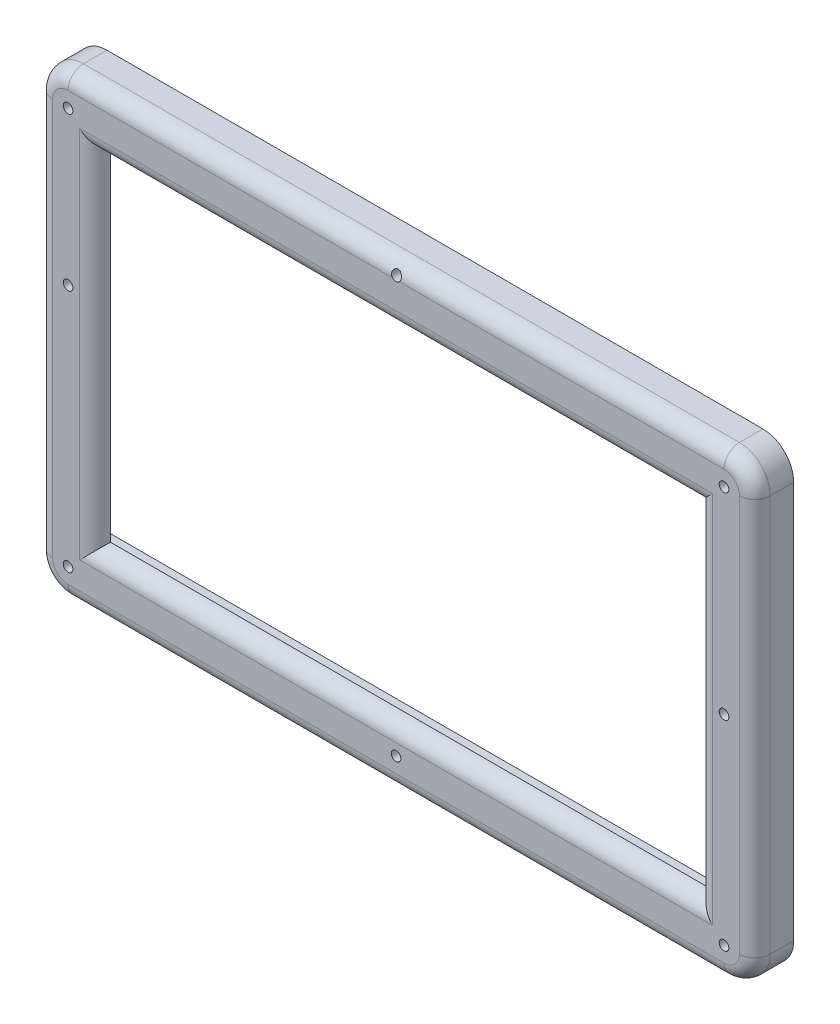
from build123d import *

# Parameters (mm, degrees)
SKETCH1_R           = 1.25
SKETCH1_W           = 156.43
SKETCH1_H           = 89.15
BOSS_EXTRUDE1_DEPTH = 4
BOSS_EXTRUDE2_START = -6.1
SKETCH1_3_R         = 1.25
BOSS_EXTRUDE2_DEPTH = 6.1
FILLET1_R           = 4
SKETCH2_W           = 17.19
SKETCH2_H           = 6.1
CUT_EXTRUDE1_DEPTH  = 1
SKETCH3_W           = 6.1
SKETCH3_H           = 11.97
CUT_EXTRUDE2_DEPTH  = 1
SKETCH4_R           = 1.25
CUT_EXTRUDE3_DEPTH  = 125.056407333


with BuildPart() as part:
    # Sketch1 → Boss-Extrude1 (new body)
    with BuildSketch(Plane.XY):
        with BuildLine():
            Line((-98.129170507, 35.926013825), (-98.129170507, -67.223986175))
            ThreePointArc((-98.129170507, -67.223986175), (-95.786024756, -72.880840425), (-90.129170507, -75.223986175))
            Line((-90.129170507, -75.223986175), (80.300829493, -75.223986175))
            ThreePointArc((80.300829493, -75.223986175), (85.957683743, -72.880840425), (88.300829493, -67.223986175))
            Line((88.300829493, -67.223986175), (88.300829493, 35.926013825))
            ThreePointArc((88.300829493, 35.926013825), (85.957683743, 41.582868074), (80.300829493, 43.926013825))
            Line((80.300829493, 43.926013825), (-90.129170507, 43.926013825))
            ThreePointArc((-90.129170507, 43.926013825), (-95.786024756, 41.582868074), (-98.129170507, 35.926013825))
        make_face()
        with Locations((80.300829493, 35.926013825)):
            Circle(SKETCH1_R, mode=Mode.SUBTRACT)
        with Locations((80.300829493, -67.223986175)):
            Circle(SKETCH1_R, mode=Mode.SUBTRACT)
        with Locations((-90.129170507, -67.223986175)):
            Circle(SKETCH1_R, mode=Mode.SUBTRACT)
        with Locations((-90.129170507, 35.926013825)):
            Circle(SKETCH1_R, mode=Mode.SUBTRACT)
        with Locations((-4.914170507, -15.648986175)):
            Rectangle(SKETCH1_W, SKETCH1_H, mode=Mode.SUBTRACT)
    extrude(amount=BOSS_EXTRUDE1_DEPTH)

    # Sketch1<3> → Boss-Extrude2 (add)
    with BuildSketch(Plane.XY.offset(BOSS_EXTRUDE2_START)):
        with BuildLine():
            ThreePointArc((-90.129170507, 43.926013825), (-95.786024756, 41.582868074), (-98.129170507, 35.926013825))
            Line((-98.129170507, 35.926013825), (-98.129170507, -67.223986175))
            ThreePointArc((-98.129170507, -67.223986175), (-95.786024756, -72.880840425), (-90.129170507, -75.223986175))
            Line((-90.129170507, -75.223986175), (80.300829493, -75.223986175))
            ThreePointArc((80.300829493, -75.223986175), (85.957683743, -72.880840425), (88.300829493, -67.223986175))
            Line((88.300829493, -67.223986175), (88.300829493, 35.926013825))
            ThreePointArc((88.300829493, 35.926013825), (85.957683743, 41.582868074), (80.300829493, 43.926013825))
            Line((80.300829493, 43.926013825), (-90.129170507, 43.926013825))
        make_face()
        with Locations((-90.129170507, -67.223986175)):
            Circle(SKETCH1_3_R, mode=Mode.SUBTRACT)
        with Locations((80.300829493, -67.223986175)):
            Circle(SKETCH1_3_R, mode=Mode.SUBTRACT)
        with BuildLine():
            Line((-89.239170507, -64.383986175), (-89.239170507, 35.048289495))
            ThreePointArc((-89.239170507, 35.048289495), (-91.378326538, 35.97193996), (-89.177120088, 36.736013825))
            Line((-89.177120088, 36.736013825), (76.680829493, 36.736013825))
            Line((76.680829493, 36.736013825), (76.680829493, -64.383986175))
            Line((76.680829493, -64.383986175), (-89.239170507, -64.383986175))
        make_face(mode=Mode.SUBTRACT)
        with Locations((80.300829493, 35.926013825)):
            Circle(SKETCH1_3_R, mode=Mode.SUBTRACT)
    extrude(amount=BOSS_EXTRUDE2_DEPTH)

    # Fillet1
    fillet1_edges = [part.edges().sort_by_distance(p)[0] for p in [
        (-95.786024756, 41.582868074, 4),
        (-4.914170507, 43.926013825, 4),
        (85.957683743, 41.582868074, 4),
        (88.300829493, -15.648986175, 4),
        (85.957683743, -72.880840425, 4),
        (-4.914170507, -75.223986175, 4),
        (-95.786024756, -72.880840425, 4),
        (-4.914170507, -60.223986175, 4),
        (-4.914170507, 28.926013825, 4),
        (-83.129170507, -15.648986175, 4),
        (73.300829493, -15.648986175, 4),
        (-98.129170507, -15.648986175, 4),
    ]]
    fillet(fillet1_edges, radius=FILLET1_R - 0.0001)  # a hair under: the kernel refuses the full size

    # Sketch2 → Cut-Extrude1 (cut)
    with BuildSketch(Plane.XZ.offset(-36.736013825)):
        with Locations((-30.314170507, -3.05)):
            Rectangle(SKETCH2_W, SKETCH2_H)
    extrude(amount=-CUT_EXTRUDE1_DEPTH, mode=Mode.SUBTRACT)

    # Sketch3 → Cut-Extrude2 (cut)
    with BuildSketch(Plane.ZY.offset(-76.680829493)):
        with Locations((-3.05, -16.608986175)):
            Rectangle(SKETCH3_W, SKETCH3_H)
    extrude(amount=-CUT_EXTRUDE2_DEPTH, mode=Mode.SUBTRACT)

    # Sketch4 → Cut-Extrude3 (cut, through all)
    with BuildSketch(Plane(origin=(0, 0, -6.1), x_dir=(-1, 0, 0), z_dir=(0, 0, -1))):
        with Locations((4.909170507, 40.776013825)):
            Circle(SKETCH4_R)
        with Locations((-80.300829493, -15.243986175)):
            Circle(SKETCH4_R)
        with Locations((4.909170507, -67.223986175)):
            Circle(SKETCH4_R)
        with Locations((90.129170507, -3.883986175)):
            Circle(SKETCH4_R)
    extrude(amount=-CUT_EXTRUDE3_DEPTH, mode=Mode.SUBTRACT)


solid = part.part
